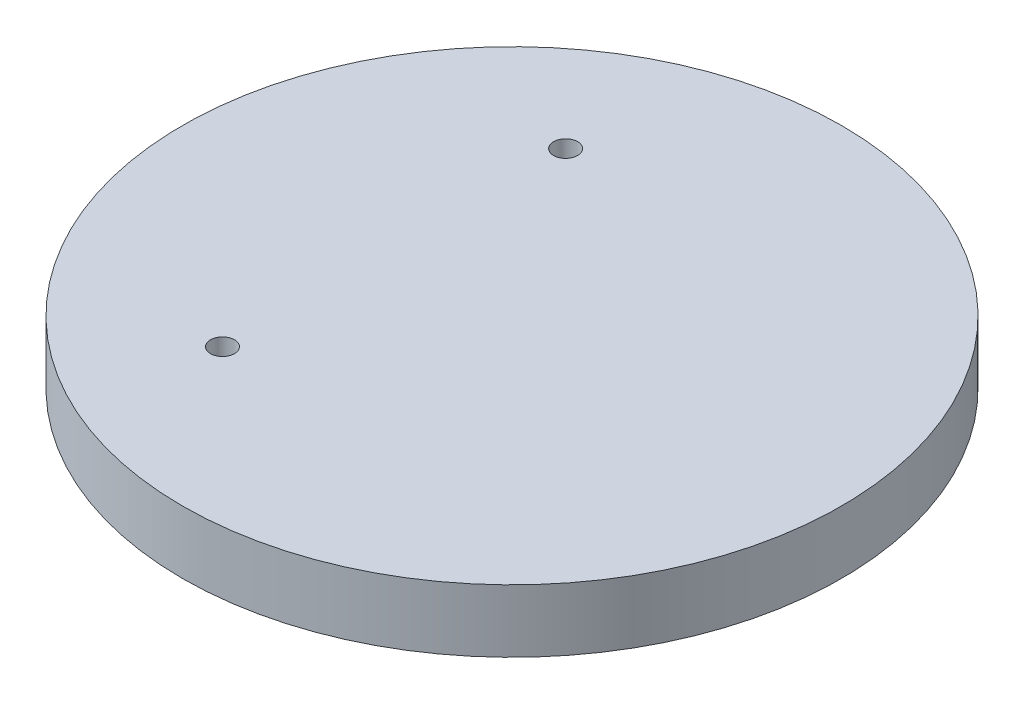
from build123d import *

# Parameters (mm, degrees)
FILLET1_R          = 10
SKETCH6_R          = 1.15
CUT_EXTRUDE1_DEPTH = 10


with BuildPart() as part:
    # Sketch2 → Revolve1 (revolve)
    with BuildSketch(Plane.XY, mode=Mode.PRIVATE) as revolve1_sk:
        Polygon((0, 4), (-2.43, 4), (-2.43, 3), (-2.43, 0), (-4.43, 0), (-4.43, 4), (-29.5, 4), (-29.5, 0), (-31.5, 0), (-31.5, 4), (-31.5, 6), (0, 6), align=None)
    revolve(revolve1_sk.sketch.rotate(Axis((0, 0, 0), (0, 1, 0)), 270), axis=Axis((0, 0, 0), (0, 1, 0)))

    # Fillet1
    # the kernel refuses this fillet: 10 mm, written as the material it adds along each edge
    with BuildSketch(Plane(origin=(0, 4, 0), x_dir=(0, 0, -1), z_dir=(1, 0, 0))) as fillet1_piece_1:
        with BuildLine():
            CenterArc((21.5, -10), FILLET1_R, 36.869897646, 53.130102354)
            Line((29.5, -4), (29.66, -3.88))
            ThreePointArc((29.66, -3.88), (29.7, -2), (29.7, 0))
            Line((29.7, 0), (29.5, 0.2))
            Line((29.5, 0.2), (21.5, 0.2))
            Line((21.5, 0.2), (21.5, 0))
        make_face()
    revolve(axis=Axis((0, 4, 0), (0, 1, 0)))
    with BuildSketch(Plane(origin=(0, 4, 0), x_dir=(0, 0, -1), z_dir=(1, 0, 0))) as fillet1_piece_2:
        with BuildLine():
            CenterArc((12.43, -10), FILLET1_R, 90, 53.130102354)
            Line((12.43, 0), (12.43, 0.2))
            Line((12.43, 0.2), (4.43, 0.2))
            Line((4.43, 0.2), (4.23, 0))
            ThreePointArc((4.23, 0), (4.23, -2), (4.27, -3.88))
            Line((4.27, -3.88), (4.43, -4))
        make_face()
    revolve(axis=Axis((0, 4, 0), (0, 1, 0)))

    # Sketch6 → Cut-Extrude1 (cut)
    with BuildSketch(Plane(origin=(0, 6, 0), x_dir=(1, 0, 0), z_dir=(0, 1, 0))):
        with Locations(Location((-11.275, 16.4, 0), (0, 0, 270))):
            Circle(SKETCH6_R)
        with Locations(Location((-11.275, -16.4, 0), (0, 0, 270))):
            Circle(SKETCH6_R)
    extrude(amount=-CUT_EXTRUDE1_DEPTH, mode=Mode.SUBTRACT)


solid = part.part
